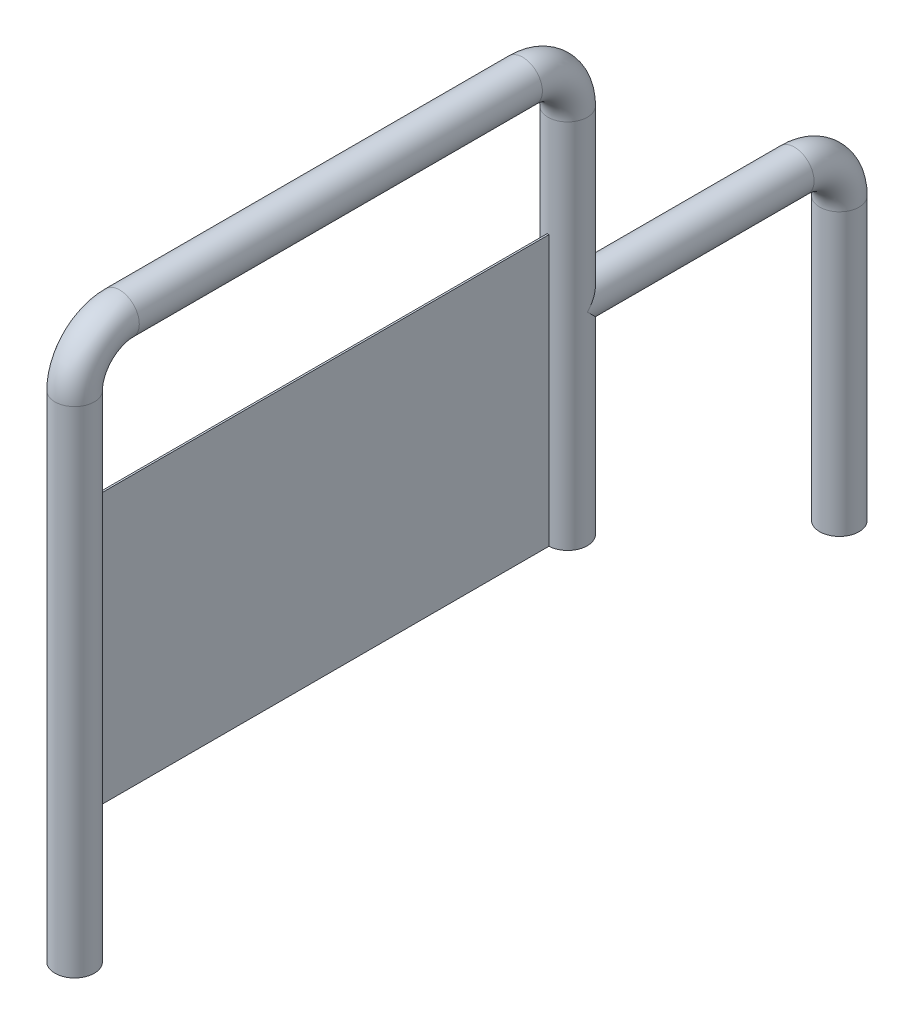
from build123d import *

# Parameters (mm, degrees)
CROQUIS1_R                   = 11.1125
BARRER2_OUTLINE_W            = 11.1125
BARRER2_OUTLINE_H            = 209.55
SALIENTE_EXTRUIR1_DEPTH      = 0.508
SALIENTE_EXTRUIR1_DEPTH_BACK = 0.508
CROQUIS3_W                   = 256.175
CROQUIS3_H                   = 152.4


# Read off the part's stored shape, not the designer's step: Barrer2
with BuildPart() as part:
    # Barrer1: sweep along a path in Croquis2
    with BuildLine(Plane(origin=(0, 0, 0), x_dir=(0, 0, -1), z_dir=(1, 0, 0))) as barrer1_path:
        Line((0, 0), (0, 279.4))
        ThreePointArc((0, 279.4), (7.439487758, 297.360512242), (25.4, 304.8))
        Line((25.4, 304.8), (253, 304.8))
        ThreePointArc((253, 304.8), (270.960512242, 297.360512242), (278.4, 279.4))
        Line((278.4, 279.4), (278.4, 184.15))
        Line((278.4, 184.15), (406.4, 184.15))
        ThreePointArc((406.4, 184.15), (424.360512242, 176.710512242), (431.8, 158.75))
        Line((431.8, 158.75), (431.8, 0))
    # Croquis1 → Barrer1 (sweep)
    with BuildSketch(Plane(origin=(0, 0, 0), x_dir=(1, 0, 0), z_dir=(0, 1, 0))):
        Circle(CROQUIS1_R)
    sweep(path=barrer1_path.line, transition=Transition.RIGHT)

    # Barrer2 outline → Barrer2 (revolve)
    with BuildSketch(Plane.XY.offset(-278.4)):
        with Locations((5.55625, 174.625)):
            Rectangle(BARRER2_OUTLINE_W, BARRER2_OUTLINE_H)
    revolve(axis=Axis((0, 0, -278.4), (0, 1, 0)))


with BuildPart() as body_2:
    # Croquis3 → Saliente-Extruir1 (new, two sides: drawn at the far end of the back side and taken through both)
    with BuildSketch(Plane(origin=(0, 0, 0), x_dir=(0, 0, -1), z_dir=(1, 0, 0)).offset(-SALIENTE_EXTRUIR1_DEPTH_BACK)):
        with Locations((139.2, 146.05)):
            Rectangle(CROQUIS3_W, CROQUIS3_H)
    extrude(amount=SALIENTE_EXTRUIR1_DEPTH + SALIENTE_EXTRUIR1_DEPTH_BACK)


solid = Compound([part.part, body_2.part])
